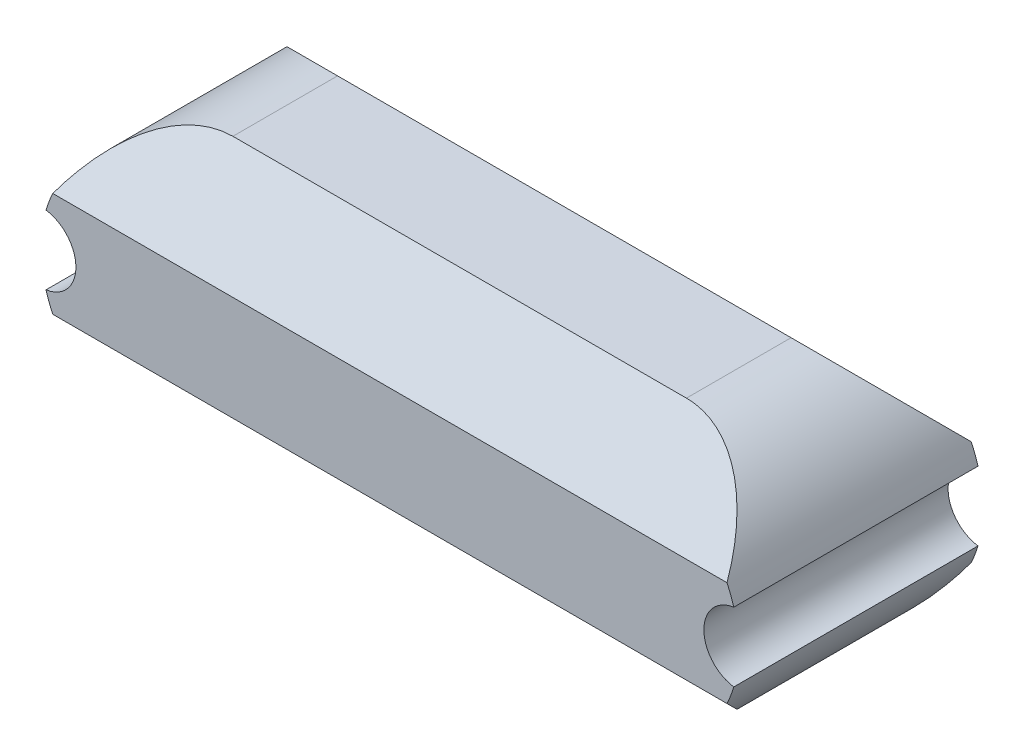
from build123d import *

# Parameters (mm, degrees)
IZIM1_W                     = 100
IZIM1_H                     = 35
Y_KSEKLIK_EKSTR_ZYON1_DEPTH = 35
RADYUS1_R                   = 17.5
RADYUS2_R                   = 17.5
RADYUS3_R                   = 17.5
IZIM2_R                     = 5
KES_EKSTR_ZYON1_DEPTH       = 64.492125496
PAH2_SIZE                   = 10
PAH3_SIZE                   = 10


# Some blends are built 0.0001 mm under size
with BuildPart() as part:
    # Çizim1 → Yükseklik-Ekstrüzyon1 (new body)
    with BuildSketch(Plane.XY):
        Rectangle(IZIM1_W, IZIM1_H)
    extrude(amount=Y_KSEKLIK_EKSTR_ZYON1_DEPTH)

    # Radyus1
    radyus1_edges = [part.edges().sort_by_distance(p)[0] for p in [
        (-50, 17.5, 17.5),
    ]]
    fillet(radyus1_edges, radius=RADYUS1_R)

    # Radyus2
    radyus2_edges = [part.edges().sort_by_distance(p)[0] for p in [
        (-50, -17.5, 17.5),
    ]]
    fillet(radyus2_edges, radius=RADYUS2_R - 0.0001)  # a hair under: the kernel refuses the full size

    # Radyus3
    radyus3_edges = [part.edges().sort_by_distance(p)[0] for p in [
        (50, -17.5, 17.5),
        (50, 17.5, 17.5),
    ]]
    fillet(radyus3_edges, radius=RADYUS3_R - 0.0001)  # a hair under: the kernel refuses the full size

    # Çizim2 → Kes-Ekstrüzyon1 (cut, through all)
    with BuildSketch(Plane.XY.offset(35)):
        with Locations((-50, 0)):
            Circle(IZIM2_R)
        with Locations((50, 0)):
            Circle(IZIM2_R)
    extrude(amount=-KES_EKSTR_ZYON1_DEPTH, mode=Mode.SUBTRACT)

    # Pah2
    # the kernel refuses this chamfer: 10 mm, written as the material it takes off along each edge
    with BuildSketch(Plane(origin=(-58.21682988, 17.5, 0), x_dir=(0, -0.9996219169112968, -0.027495876610586372), z_dir=(1, 0, 0))) as pah2_piece_1:
        Polygon((PAH2_SIZE * 0.999621916911, -PAH2_SIZE * 0.0274958766106), (-PAH2_SIZE * 0.0274958766106, -PAH2_SIZE * 0.999621916911), (0, 0), align=None)
    extrude(amount=116.433759759, mode=Mode.SUBTRACT)

    # Pah3
    # the kernel refuses this chamfer: 10 mm, written as the material it takes off along each edge
    with BuildSketch(Plane(origin=(58.21692988, -17.5, 0), x_dir=(0, 0.9996219169112968, -0.027495876610586372), z_dir=(-1, 0, 0)), Plane(origin=(58.21692988, -17.5, 35), x_dir=(0, -0.027495876610586317, -0.9996219169112968), z_dir=(-1, 0, 0))) as pah3_piece_1:
        Polygon((PAH3_SIZE * 0.999621916911, -PAH3_SIZE * 0.0274958766106), (-PAH3_SIZE * 0.0274958766106, -PAH3_SIZE * 0.999621916911), (0, 0), align=None)
    extrude(amount=116.433859759, mode=Mode.SUBTRACT)
    with BuildSketch(Plane(origin=(-58.21682988, 17.5, 35), x_dir=(0, -0.9996219169112968, 0.027495876610586317), z_dir=(1, 0, 0))) as pah3_piece_2:
        Polygon((PAH3_SIZE * 0.999621916911, PAH3_SIZE * 0.0274958766106), (-PAH3_SIZE * 0.0274958766106, PAH3_SIZE * 0.999621916911), (0, 0), align=None)
    extrude(amount=116.433759759, mode=Mode.SUBTRACT)


solid = part.part
